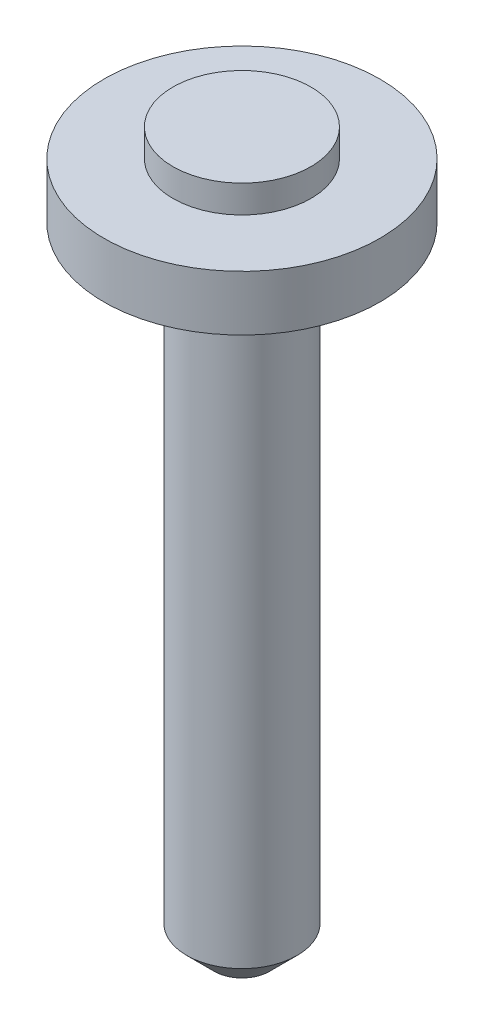
from build123d import *

# Parameters (mm, degrees)
CHAMFER1_SIZE       = 1
SKETCH2_R           = 2.5
BOSS_EXTRUDE1_DEPTH = 1


with BuildPart() as part:
    # Sketch1 → Revolve1 (revolve)
    with BuildSketch(Plane.XY):
        Polygon((0, 25), (-5, 25), (-5, 23), (-2.5, 23), (-2.5, 22), (-2, 22), (-2, 0), (-0.45, 0), (-0.45, 19), (0, 19), align=None)
    revolve(axis=Axis((0, 0, 0), (0, 1, 0)))

    # Chamfer1
    chamfer1_edges = [part.edges().sort_by_distance(p)[0] for p in [
        (2, 0, 0),
    ]]
    chamfer(chamfer1_edges, length=CHAMFER1_SIZE)

    # Sketch2 → Boss-Extrude1 (add)
    with BuildSketch(Plane(origin=(0, 25, 0), x_dir=(1, 0, 0), z_dir=(0, 1, 0))):
        Circle(SKETCH2_R)
    extrude(amount=BOSS_EXTRUDE1_DEPTH)


solid = part.part
